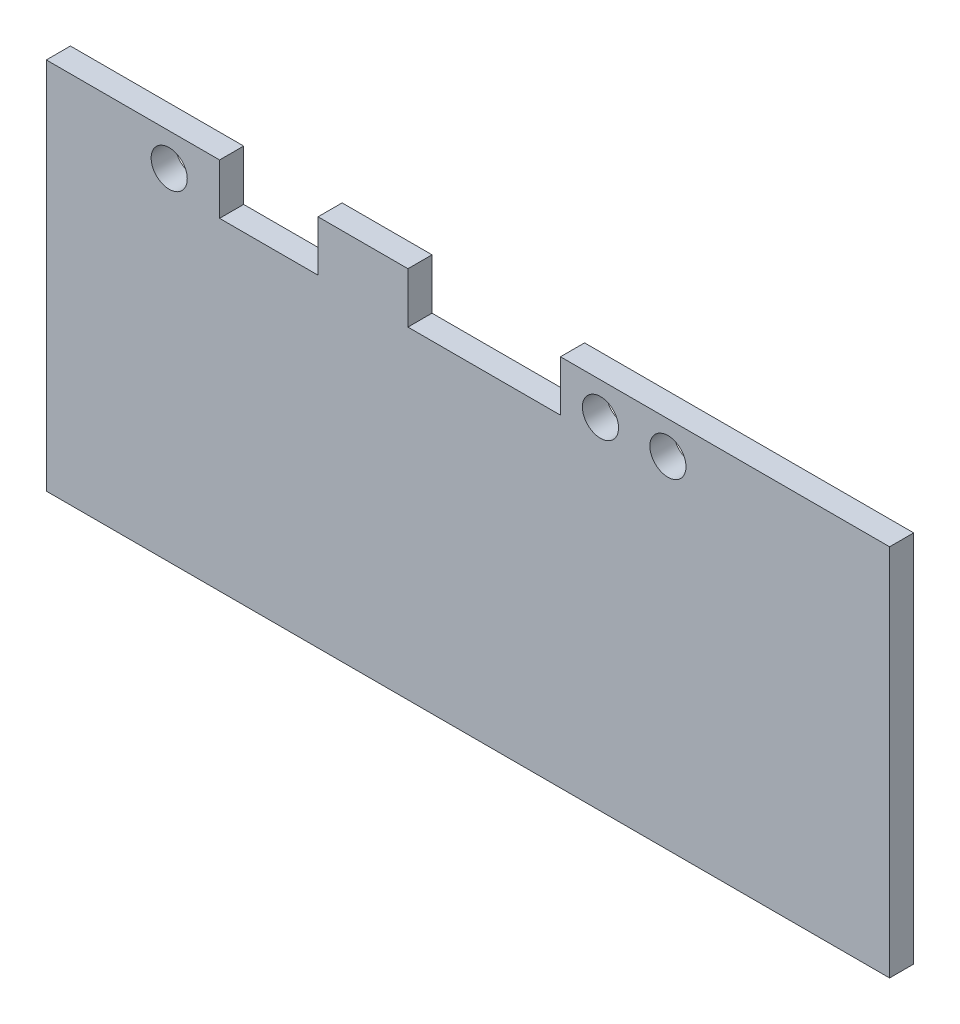
from build123d import *

# Parameters (mm, degrees)
BOSS_EXTRUDE3_DEPTH     = 1
CUT_EXTRUDE1_DEPTH      = 212.368278774
CUT_EXTRUDE1_DEPTH_BACK = 212.368278774
SKETCH3_R               = 0.75


with BuildPart() as part:
    # Boss-Extrude1: read off the stored shape, not the designer's step
    # Boss-Extrude1: loft between two sections, ruled curve by curve
    boss_extrude1_from = [
        Edge.make_line((175.558, 102.207, 0), (175.558, 117.707, 0)),
        Edge.make_line((175.558, 117.707, 0), (161.898, 117.707, 0)),
        Edge.make_line((161.898, 117.707, 0), (161.898, 115.608, 0)),
        Edge.make_line((161.898, 115.608, 0), (155.567, 115.608, 0)),
        Edge.make_line((155.567, 115.608, 0), (155.567, 117.707, 0)),
        Edge.make_line((155.567, 117.707, 0), (151.835, 117.707, 0)),
        Edge.make_line((151.835, 117.707, 0), (151.835, 115.608, 0)),
        Edge.make_line((151.835, 115.608, 0), (147.749, 115.608, 0)),
        Edge.make_line((147.749, 115.608, 0), (147.749, 117.707, 0)),
        Edge.make_line((147.749, 117.707, 0), (140.558, 117.707, 0)),
        Edge.make_line((140.558, 117.707, 0), (140.558, 102.207, 0)),
        Edge.make_line((140.558, 102.207, 0), (141.514, 102.2075, 0)),
        Edge.make_line((141.514, 102.2075, 0), (141.504, 102.212, 0)),
        Edge.make_line((141.504, 102.212, 0), (141.5, 102.222, 0)),
        Edge.make_line((141.5, 102.222, 0), (141.5, 106.293, 0)),
        Edge.make_line((141.5, 106.293, 0), (141.504, 106.303, 0)),
        Edge.make_line((141.504, 106.303, 0), (141.514, 106.307, 0)),
        Edge.make_line((141.514, 106.307, 0), (143.136, 106.307, 0)),
        Edge.make_line((143.136, 106.307, 0), (143.146, 106.303, 0)),
        Edge.make_line((143.146, 106.303, 0), (143.15, 106.293, 0)),
        Edge.make_line((143.15, 106.293, 0), (143.15, 102.222, 0)),
        Edge.make_line((143.15, 102.222, 0), (143.146, 102.212, 0)),
        Edge.make_line((143.146, 102.212, 0), (143.136, 102.2075, 0)),
        Edge.make_line((143.136, 102.2075, 0), (175.558, 102.207, 0)),
    ]
    boss_extrude1_to = [
        Edge.make_line((175.558, 102.207, 1), (175.558, 117.707, 1)),
        Edge.make_line((175.558, 117.707, 1), (161.898, 117.707, 1)),
        Edge.make_line((161.898, 117.707, 1), (161.898, 115.608, 1)),
        Edge.make_line((161.898, 115.608, 1), (155.567, 115.608, 1)),
        Edge.make_line((155.567, 115.608, 1), (155.567, 117.707, 1)),
        Edge.make_line((155.567, 117.707, 1), (151.835, 117.707, 1)),
        Edge.make_line((151.835, 117.707, 1), (151.835, 115.608, 1)),
        Edge.make_line((151.835, 115.608, 1), (147.749, 115.608, 1)),
        Edge.make_line((147.749, 115.608, 1), (147.749, 117.707, 1)),
        Edge.make_line((147.749, 117.707, 1), (140.558, 117.707, 1)),
        Edge.make_line((140.558, 117.707, 1), (140.558, 102.207, 1)),
        Edge.make_line((140.558, 102.207, 1), (141.514, 102.2075, 1)),
        Edge.make_line((141.514, 102.2075, 1), (141.504, 102.212, 1)),
        Edge.make_line((141.504, 102.212, 1), (141.5, 102.222, 1)),
        Edge.make_line((141.5, 102.222, 1), (141.5, 106.293, 1)),
        Edge.make_line((141.5, 106.293, 1), (141.504, 106.303, 1)),
        Edge.make_line((141.504, 106.303, 1), (141.514, 106.307, 1)),
        Edge.make_line((141.514, 106.307, 1), (143.136, 106.307, 1)),
        Edge.make_line((143.136, 106.307, 1), (143.146, 106.303, 1)),
        Edge.make_line((143.146, 106.303, 1), (143.15, 106.293, 1)),
        Edge.make_line((143.15, 106.293, 1), (143.15, 102.222, 1)),
        Edge.make_line((143.15, 102.222, 1), (143.146, 102.212, 1)),
        Edge.make_line((143.146, 102.212, 1), (143.136, 102.2075, 1)),
        Edge.make_line((143.136, 102.2075, 1), (175.558, 102.207, 1)),
    ]
    boss_extrude1 = Solid(Shell([*[Face.make_surface_from_curves(boss_extrude1_from[k], boss_extrude1_to[k]) for k in range(24)], Face(Wire(boss_extrude1_from)), Face(Wire(boss_extrude1_to))]))
    add(boss_extrude1)

    # Sketch2 → Boss-Extrude3 (add)
    with BuildSketch(Plane.XY.offset(1)):
        Polygon((140.906858982, 106.861348972), (140.558, 102.207), (144.371699547, 102.207480944), (144.371699547, 106.861348972), align=None)
    extrude(amount=-BOSS_EXTRUDE3_DEPTH)

    # Sketch3 → Cut-Extrude1 (cut, two sides: drawn at the far end of the back side and taken through both)
    with BuildSketch(Plane.XY.offset(1).offset(-CUT_EXTRUDE1_DEPTH_BACK)):
        with Locations((145.658, 116.356)):
            Circle(SKETCH3_R)
        with Locations((163.558, 116.356)):
            Circle(SKETCH3_R)
        with Locations((166.358, 116.356)):
            Circle(SKETCH3_R)
    extrude(amount=CUT_EXTRUDE1_DEPTH + CUT_EXTRUDE1_DEPTH_BACK, mode=Mode.SUBTRACT)


solid = part.part
